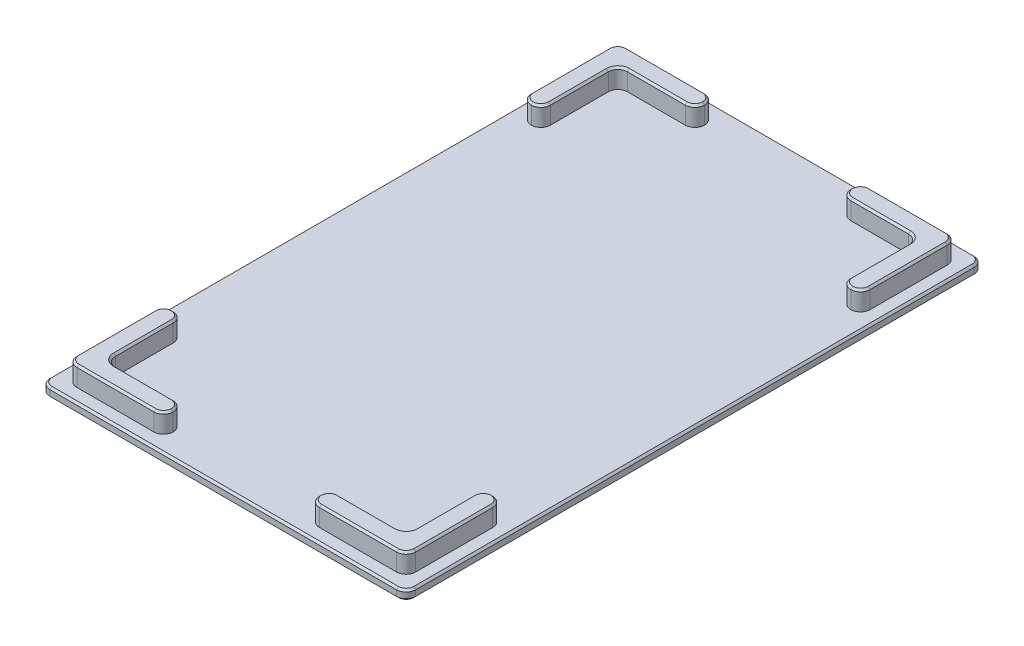
from build123d import *

# Parameters (mm, degrees)
SKETCH1_W           = 95
SKETCH1_H           = 150
SKETCH1_W_2         = 90
SKETCH1_H_2         = 145
BOSS_EXTRUDE1_DEPTH = 2.5
BOSS_EXTRUDE2_DEPTH = 5
FILLET1_R           = 2.5
CHAMFER1_SIZE       = 0.5


with BuildPart() as part:
    # Sketch1 → Boss-Extrude1 (new body)
    # profile 1 of 2: a face of its own
    with BuildSketch(Plane(origin=(0, 0, 0), x_dir=(1, 0, 0), z_dir=(0, 1, 0))):
        with Locations((0, 75)):
            Rectangle(SKETCH1_W, SKETCH1_H)
        with Locations((0, 75)):
            Rectangle(SKETCH1_W_2, SKETCH1_H_2, mode=Mode.SUBTRACT)
    # profile 2 of 2: a face of its own
    with BuildSketch(Plane(origin=(0, 0, 0), x_dir=(1, 0, 0), z_dir=(0, 1, 0))):
        with Locations((0, 75)):
            Rectangle(SKETCH1_W_2, SKETCH1_H_2)
    extrude(amount=BOSS_EXTRUDE1_DEPTH)

    # Sketch2 → Boss-Extrude2 (add)
    with BuildSketch(Plane(origin=(0, 2.5, 0), x_dir=(1, 0, 0), z_dir=(0, 1, 0))):
        Polygon((-19, 8.5), (-19, 3.5), (-44, 3.5), (-44, 28.5), (-39, 28.5), (-39, 8.5), align=None)
        Polygon((19, 3.5), (19, 8.5), (39, 8.5), (39, 28.5), (44, 28.5), (44, 3.5), align=None)
        Polygon((-44, 146.5), (-44, 121.5), (-39, 121.5), (-39, 141.5), (-19, 141.5), (-19, 146.5), align=None)
        Polygon((39, 121.5), (44, 121.5), (44, 146.5), (19, 146.5), (19, 141.5), (39, 141.5), align=None)
    extrude(amount=BOSS_EXTRUDE2_DEPTH)

    # Fillet1
    fillet1_edges = [part.edges().sort_by_distance(p)[0] for p in [
        (47.5, 1.25, -150),
        (47.5, 1.25, 0),
        (-47.5, 1.25, 0),
        (-47.5, 1.25, -150),
        (44, 5, -146.5),
        (19, 5, -146.5),
        (19, 5, -141.5),
        (39, 5, -141.5),
        (39, 5, -121.5),
        (44, 5, -121.5),
        (-19, 5, -8.5),
        (-39, 5, -8.5),
        (-39, 5, -28.5),
        (-44, 5, -28.5),
        (-44, 5, -3.5),
        (-19, 5, -3.5),
        (-19, 5, -146.5),
        (-44, 5, -121.5),
        (-39, 5, -121.5),
        (-39, 5, -141.5),
        (-19, 5, -141.5),
        (19, 5, -3.5),
        (44, 5, -3.5),
        (44, 5, -28.5),
        (39, 5, -28.5),
        (39, 5, -8.5),
        (19, 5, -8.5),
        (-44, 5, -146.5),
    ]]
    fillet(fillet1_edges, radius=FILLET1_R - 0.0001)  # a hair under: the kernel refuses the full size

    # Chamfer1
    chamfer1_edges = [part.edges().sort_by_distance(p)[0] for p in [
        (-47.5, 2.5, -75),
        (0, 2.5, 0),
        (-46.767796242, 2.5, -149.267796242),
        (-46.767796242, 2.5, -0.732203758),
        (46.767796242, 2.5, -0.732203758),
        (46.767796242, 2.5, -149.267796242),
        (31.5, 7.5, -146.5),
        (44, 7.5, -134),
        (29, 7.5, -141.5),
        (39, 7.5, -131.5),
        (43.267796242, 7.5, -122.232203758),
        (39.732203758, 7.5, -122.232203758),
        (19.732203758, 7.5, -142.232203758),
        (19.732203758, 7.5, -145.767796242),
        (43.267796242, 7.5, -145.767796242),
        (-29, 7.5, -8.5),
        (-39, 7.5, -18.5),
        (-44, 7.5, -16),
        (-31.5, 7.5, -3.5),
        (-19.732203758, 7.5, -4.232203758),
        (-19.732203758, 7.5, -7.767796242),
        (-43.267796242, 7.5, -4.232203758),
        (-43.267796242, 7.5, -27.767796242),
        (-39.732203758, 7.5, -27.767796242),
        (-31.5, 7.5, -146.5),
        (-44, 7.5, -134),
        (-39, 7.5, -131.5),
        (-29, 7.5, -141.5),
        (-43.267796242, 7.5, -145.767796242),
        (-19.732203758, 7.5, -142.232203758),
        (-19.732203758, 7.5, -145.767796242),
        (-39.732203758, 7.5, -122.232203758),
        (-43.267796242, 7.5, -122.232203758),
        (31.5, 7.5, -3.5),
        (44, 7.5, -16),
        (39, 7.5, -18.5),
        (29, 7.5, -8.5),
        (19.732203758, 7.5, -7.767796242),
        (19.732203758, 7.5, -4.232203758),
        (39.732203758, 7.5, -27.767796242),
        (43.267796242, 7.5, -27.767796242),
        (43.267796242, 7.5, -4.232203758),
        (38.267796242, 7.5, -140.767796242),
        (-38.267796242, 7.5, -9.232203758),
        (-38.267796242, 7.5, -140.767796242),
        (38.267796242, 7.5, -9.232203758),
        (0, 0, -150),
        (0, 2.5, -150),
        (47.5, 0, -75),
        (0, 0, 0),
        (-47.5, 0, -75),
        (-46.767796242, 0, -149.267796242),
        (-46.767796242, 0, -0.732203758),
        (46.767796242, 0, -0.732203758),
        (46.767796242, 0, -149.267796242),
        (47.5, 2.5, -75),
    ]]
    chamfer(chamfer1_edges, length=CHAMFER1_SIZE)


solid = part.part
